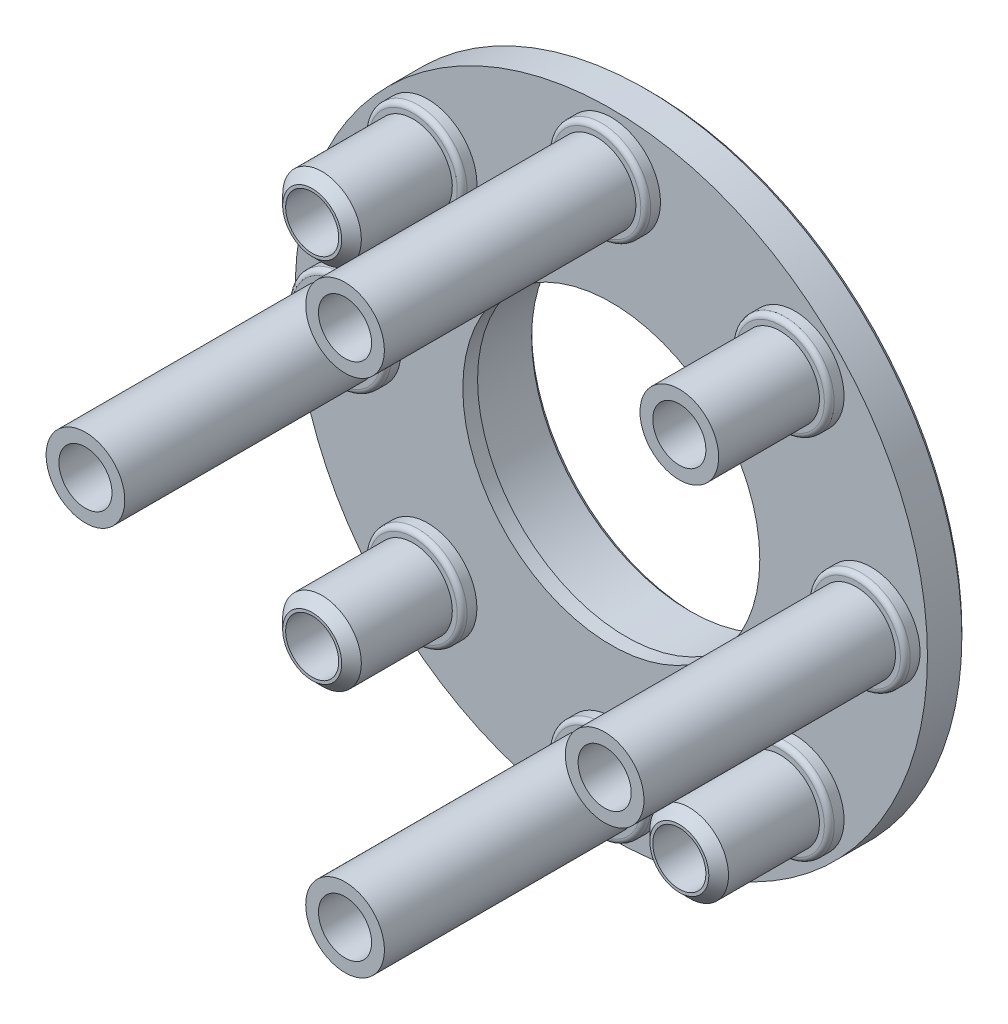
from build123d import *

# Parameters (mm, degrees)
SKETCH1_R                = 32.15
SKETCH1_R_2              = 2.7
BOSS_EXTRUDE1_DEPTH      = 4
SKETCH2_R                = 4
SKETCH2_R_2              = 2.7
BOSS_EXTRUDE2_DEPTH      = 27.07546845
SKETCH3_R                = 5
SKETCH3_R_2              = 4
BOSS_EXTRUDE3_DEPTH      = 1.5
FILLET2_R                = 0.5
CIRPATTERN1_COUNT        = 8
FILLET2_OF_CIRPATTERN1_R = 0.5
CHAMFER1_SIZE            = 0.5
SKETCH9_R                = 8
CUT_EXTRUDE4_DEPTH       = 53.918106464
BOSS_EXTRUDE7_START      = -6.5
SKETCH10_R               = 8
SKETCH10_R_2             = 6.5
BOSS_EXTRUDE7_DEPTH      = 6.5
CUT_EXTRUDE5_DEPTH       = 53.918106464
CUT_EXTRUDE5_DEPTH_BACK  = 53.918106464
SKETCH14_R               = 16.1
SKETCH15_R               = 16.1
SKETCH15_R_2             = 15.1
BOSS_EXTRUDE8_DEPTH      = 1.5
SKETCH16_R               = 18.1
SKETCH16_R_2             = 16.1
BOSS_EXTRUDE9_DEPTH      = 4.5
CHAMFER3_SIZE2           = 4.5
CHAMFER3_SIZE            = 2
CUT_EXTRUDE3_START       = -5
SKETCH7_R                = 4.45
CUT_EXTRUDE3_DEPTH       = 61.072041358
CIRPATTERN2_COUNT        = 8
CHAMFER4_SIZE            = 0.5
SKETCH17_R               = 6.596186261
CUT_EXTRUDE6_DEPTH       = 15.32546845
CIRPATTERN3_COUNT        = 4
CHAMFER5_SIZE            = 1


with BuildPart() as part:
    # Sketch1 → Boss-Extrude1 (new body)
    with BuildSketch(Plane.XY):
        Circle(SKETCH1_R)
        with Locations((0, 26.4)):
            Circle(SKETCH1_R_2, mode=Mode.SUBTRACT)
        with Locations((26.4, 0)):
            Circle(SKETCH1_R_2, mode=Mode.SUBTRACT)
        with Locations((0, -26.4)):
            Circle(SKETCH1_R_2, mode=Mode.SUBTRACT)
        with Locations((-26.4, 0)):
            Circle(SKETCH1_R_2, mode=Mode.SUBTRACT)
    extrude(amount=BOSS_EXTRUDE1_DEPTH)

    # Sketch2 → Boss-Extrude2 (add)
    with BuildSketch(Plane.XY.offset(4)):
        with Locations((0, 26.4)):
            Circle(SKETCH2_R)
        with Locations((0, 26.4)):
            Circle(SKETCH2_R_2, mode=Mode.SUBTRACT)
    boss_extrude2 = extrude(amount=BOSS_EXTRUDE2_DEPTH)

    # Sketch3 → Boss-Extrude3 (add)
    with BuildSketch(Plane.XY.offset(4)):
        with Locations((0, 26.4)):
            Circle(SKETCH3_R)
        with Locations((0, 26.4)):
            Circle(SKETCH3_R_2, mode=Mode.SUBTRACT)
    boss_extrude3 = extrude(amount=BOSS_EXTRUDE3_DEPTH)

    # Fillet2
    fillet2_edges = [part.edges().sort_by_distance(p)[0] for p in [
        (-5, 26.4, 5.5),
    ]]
    fillet(fillet2_edges, radius=FILLET2_R)

    # CirPattern1: Boss-Extrude2, Boss-Extrude3 ×8 about axis
    cirpattern1_axis = Axis((0, 0, 0), (0, 0, 1))
    add([boss_extrude2.rotate(cirpattern1_axis, i * 360 / CIRPATTERN1_COUNT) for i in range(1, CIRPATTERN1_COUNT)])
    add([boss_extrude3.rotate(cirpattern1_axis, i * 360 / CIRPATTERN1_COUNT) for i in range(1, CIRPATTERN1_COUNT)])

    # Fillet2 of CirPattern1
    fillet2_of_cirpattern1_edges = [part.edges().sort_by_distance(p)[0] for p in [
        (-22.203152929, 15.132085117, 5.5),
        (-26.4, -5, 5.5),
        (-15.132085117, -22.203152929, 5.5),
        (5, -26.4, 5.5),
        (22.203152929, -15.132085117, 5.5),
        (26.4, 5, 5.5),
        (15.132085117, 22.203152929, 5.5),
    ]]
    fillet(fillet2_of_cirpattern1_edges, radius=FILLET2_OF_CIRPATTERN1_R)

    # Chamfer1
    chamfer1_edges = [part.edges().sort_by_distance(p)[0] for p in [
        (-32.15, 0, 0),
    ]]
    chamfer(chamfer1_edges, length=CHAMFER1_SIZE)

    # Sketch9 → Cut-Extrude4 (cut, through all)
    with BuildSketch(Plane.XY.offset(4)):
        Circle(SKETCH9_R)
    extrude(amount=-CUT_EXTRUDE4_DEPTH, mode=Mode.SUBTRACT)

    # Sketch10 → Boss-Extrude7 (add)
    with BuildSketch(Plane(origin=(0, 0, 0), x_dir=(-1, 0, 0), z_dir=(0, 0, -1)).offset(BOSS_EXTRUDE7_START)):
        Circle(SKETCH10_R)
        Circle(SKETCH10_R_2, mode=Mode.SUBTRACT)
    extrude(amount=BOSS_EXTRUDE7_DEPTH)

    # Sketch14 → Cut-Extrude5 (cut, two sides: drawn at the far end of the back side and taken through both)
    with BuildSketch(Plane.XY.offset(4).offset(-CUT_EXTRUDE5_DEPTH_BACK)):
        Circle(SKETCH14_R)
    extrude(amount=CUT_EXTRUDE5_DEPTH + CUT_EXTRUDE5_DEPTH_BACK, mode=Mode.SUBTRACT)

    # Sketch15 → Boss-Extrude8 (add)
    with BuildSketch(Plane.XY.offset(4)):
        Circle(SKETCH15_R)
        Circle(SKETCH15_R_2, mode=Mode.SUBTRACT)
    extrude(amount=-BOSS_EXTRUDE8_DEPTH)

    # Sketch16 → Boss-Extrude9 (add)
    with BuildSketch(Plane(origin=(0, 0, 0), x_dir=(-1, 0, 0), z_dir=(0, 0, -1))):
        with Locations(Location((0, 0, 0), (0, 0, 180))):
            Circle(SKETCH16_R)
        with Locations(Location((0, 0, 0), (0, 0, 180))):
            Circle(SKETCH16_R_2, mode=Mode.SUBTRACT)
    extrude(amount=BOSS_EXTRUDE9_DEPTH)

    # Chamfer3
    chamfer3_edges = [part.edges().sort_by_distance(p)[0] for p in [
        (-18.1, 0, 0),
    ]]
    chamfer3_side = [part.faces().sort_by_distance(p)[0] for p in [
        (-18.14, 0, 0),
    ]]
    chamfer(chamfer3_edges, length=CHAMFER3_SIZE - 0.0001, length2=CHAMFER3_SIZE2 - 0.0001, reference=chamfer3_side[0])  # a hair under: the kernel refuses the full size

    # Sketch7 → Cut-Extrude3 (cut)
    with BuildSketch(Plane(origin=(0, 0, 0), x_dir=(-1, 0, 0), z_dir=(0, 0, -1)).offset(CUT_EXTRUDE3_START)):
        with Locations(Location((0, 26.4, 0), (0, 0, 180))):
            Circle(SKETCH7_R)
    cut_extrude3 = extrude(amount=CUT_EXTRUDE3_DEPTH, mode=Mode.SUBTRACT)

    # CirPattern2: Cut-Extrude3 ×8 about axis
    cirpattern2_axis = Axis((0, 0, 0), (0, 0, 1))
    for i in range(1, CIRPATTERN2_COUNT):
        add(cut_extrude3.rotate(cirpattern2_axis, i * 360 / CIRPATTERN2_COUNT), mode=Mode.SUBTRACT)

    # Chamfer4
    chamfer4_edges = [part.edges().sort_by_distance(p)[0] for p in [
        (-16.1, 0, -4.5),
    ]]
    chamfer(chamfer4_edges, length=CHAMFER4_SIZE)

    # Sketch17 → Cut-Extrude6 (cut)
    with BuildSketch(Plane.XY.offset(31.07546845)):
        with Locations((-18.667619023, 18.667619023)):
            Circle(SKETCH17_R)
    cut_extrude6 = extrude(amount=-CUT_EXTRUDE6_DEPTH, mode=Mode.SUBTRACT)

    # CirPattern3: Cut-Extrude6 ×4 about axis
    cirpattern3_axis = Axis((0, 0, 0), (0, 0, 1))
    for i in range(1, CIRPATTERN3_COUNT):
        add(cut_extrude6.rotate(cirpattern3_axis, i * 360 / CIRPATTERN3_COUNT), mode=Mode.SUBTRACT)

    # Chamfer5
    chamfer5_edges = [part.edges().sort_by_distance(p)[0] for p in [
        (-21.496046148, 15.839191899, 15.75),
        (-15.839191899, -21.496046148, 15.75),
        (21.496046148, -15.839191899, 15.75),
    ]]
    chamfer(chamfer5_edges, length=CHAMFER5_SIZE)


solid = part.part
